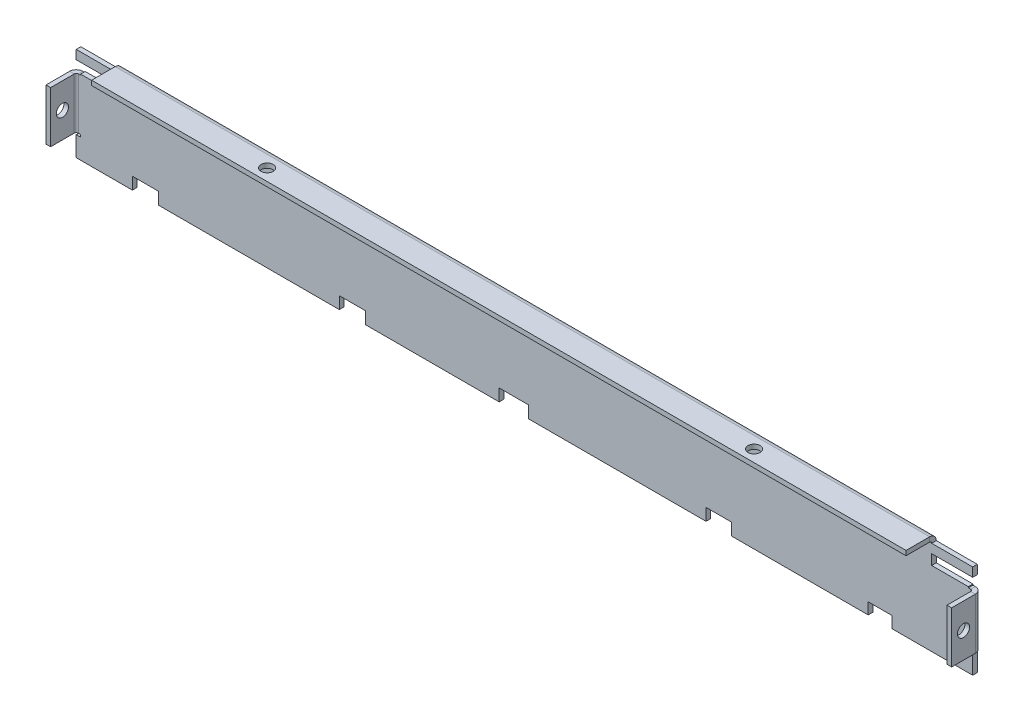
from build123d import *

# Parameters (mm, degrees)
SKETCH1_W                     = 444.26599996
SKETCH1_H                     = 47.498
BASE_FLANGE1_DEPTH            = 2.286
EDGE_FLANGE1_STRIP_W          = 11.144
EDGE_FLANGE1_STRIP_H          = 2.286
EDGE_FLANGE1_STRIP_CUT_DEPTH  = 25.4
EDGE_FLANGE1_RELIEF_W         = 12.287
EDGE_FLANGE1_RELIEF_H         = 1.143
EDGE_FLANGE1_RELIEF_CUT_DEPTH = 2.286
EDGE_FLANGE1_DEPTH            = 25.4
EDGE_FLANGE2_STRIP_W          = 11.144
EDGE_FLANGE2_STRIP_H          = 2.286
EDGE_FLANGE2_STRIP_CUT_DEPTH  = 25.4
EDGE_FLANGE2_RELIEF_W         = 12.287
EDGE_FLANGE2_RELIEF_H         = 1.143
EDGE_FLANGE2_RELIEF_CUT_DEPTH = 2.286
EDGE_FLANGE2_DEPTH            = 25.4
EDGE_FLANGE6_STRIP_W          = 11.144
EDGE_FLANGE6_STRIP_H          = 2.286
EDGE_FLANGE6_STRIP_CUT_DEPTH  = 444.26599996
EDGE_FLANGE6_DEPTH            = 444.26599996
SKETCH52_R                    = 3
CUT_EXTRUDE2_DEPTH            = 231.225159807
SKETCH53_R                    = 3
CUT_EXTRUDE3_DEPTH            = 450.771788169
SKETCH54_W                    = 20.32
SKETCH54_H                    = 3.286
CUT_EXTRUDE4_DEPTH            = 227.280796306
CUT_EXTRUDE6_DEPTH            = 227.280796306
CUT_EXTRUDE6_DEPTH_BACK       = 227.280796306
SKETCH57_W                    = 12.932384232
SKETCH57_H                    = 5.987852531
SKETCH57_W_2                  = 12.889095721
SKETCH57_H_2                  = 5.98785253
SKETCH57_W_3                  = 14.589217144
SKETCH57_H_3                  = 5.987852532
SKETCH57_W_4                  = 12.590694247
SKETCH57_H_4                  = 5.987852533
SKETCH57_W_5                  = 11.791285089
SKETCH57_H_5                  = 5.654723841


# Sheet-metal steps are written as plain solids
with BuildPart() as part:
    # Sketch1 → Base-Flange1 (new body)
    with BuildSketch(Plane.XY):
        Rectangle(SKETCH1_W, SKETCH1_H)
    extrude(amount=-BASE_FLANGE1_DEPTH)

    # Edge-Flange1 strip (across the edge) → Edge-Flange1 strip cut (cut)
    with BuildSketch(Plane(origin=(222.13299998, -12.7, 0), x_dir=(-1, 0, 0), z_dir=(0, 1, 0))):
        with Locations((-4.572, -1.143)):
            Rectangle(EDGE_FLANGE1_STRIP_W, EDGE_FLANGE1_STRIP_H)
    extrude(amount=EDGE_FLANGE1_STRIP_CUT_DEPTH, mode=Mode.SUBTRACT)

    # Edge-Flange1 relief (on the sheet) → Edge-Flange1 relief cut (cut)
    with BuildSketch(Plane(origin=(221.13299998, -12.7, 0), x_dir=(-1, 0, 0), z_dir=(0, 0, 1))):
        with Locations((-5.0005, 0.5715)):
            Rectangle(EDGE_FLANGE1_RELIEF_W, EDGE_FLANGE1_RELIEF_H)
        with Locations((-5.0005, -25.9715)):
            Rectangle(EDGE_FLANGE1_RELIEF_W, EDGE_FLANGE1_RELIEF_H)
    extrude(amount=-EDGE_FLANGE1_RELIEF_CUT_DEPTH, mode=Mode.SUBTRACT)

    # Edge-Flange1 section (across the edge) → Edge-Flange1 (add)
    with BuildSketch(Plane(origin=(222.13299998, -12.7, 0), x_dir=(-1, 0, 0), z_dir=(0, 1, 0))):
        with BuildLine():
            Line((-2.286, 1), (-2.286, 12.7))
            Line((-2.286, 12.7), (0, 12.7))
            Line((0, 12.7), (0, 1))
            ThreePointArc((0, 1), (0.292893219, 0.292893219), (1, 0))
            Line((1, 0), (1, -2.286))
            ThreePointArc((1, -2.286), (-1.323552883, -1.323552883), (-2.286, 1))
        make_face()
    extrude(amount=EDGE_FLANGE1_DEPTH)

    # Edge-Flange2 strip (across the edge) → Edge-Flange2 strip cut (cut)
    with BuildSketch(Plane(origin=(-222.13299998, 12.7, 0), x_dir=(1, 0, 0), z_dir=(0, -1, 0))):
        with Locations((-4.572, -1.143)):
            Rectangle(EDGE_FLANGE2_STRIP_W, EDGE_FLANGE2_STRIP_H)
    extrude(amount=EDGE_FLANGE2_STRIP_CUT_DEPTH, mode=Mode.SUBTRACT)

    # Edge-Flange2 relief (on the sheet) → Edge-Flange2 relief cut (cut)
    with BuildSketch(Plane(origin=(-221.13299998, 12.7, 0), x_dir=(1, 0, 0), z_dir=(0, 0, 1))):
        with Locations((-5.0005, 0.5715)):
            Rectangle(EDGE_FLANGE2_RELIEF_W, EDGE_FLANGE2_RELIEF_H)
        with Locations((-5.0005, -25.9715)):
            Rectangle(EDGE_FLANGE2_RELIEF_W, EDGE_FLANGE2_RELIEF_H)
    extrude(amount=-EDGE_FLANGE2_RELIEF_CUT_DEPTH, mode=Mode.SUBTRACT)

    # Edge-Flange2 section (across the edge) → Edge-Flange2 (add)
    with BuildSketch(Plane(origin=(-222.13299998, 12.7, 0), x_dir=(1, 0, 0), z_dir=(0, -1, 0))):
        with BuildLine():
            Line((-2.286, 1), (-2.286, 12.7))
            Line((-2.286, 12.7), (0, 12.7))
            Line((0, 12.7), (0, 1))
            ThreePointArc((0, 1), (0.292893219, 0.292893219), (1, 0))
            Line((1, 0), (1, -2.286))
            ThreePointArc((1, -2.286), (-1.323552883, -1.323552883), (-2.286, 1))
        make_face()
    extrude(amount=EDGE_FLANGE2_DEPTH)

    # Edge-Flange6 strip (across the edge) → Edge-Flange6 strip cut (cut)
    with BuildSketch(Plane(origin=(222.13299998, 23.749, 0), x_dir=(0, -1, 0), z_dir=(-1, 0, 0))):
        with Locations((-4.572, -1.143)):
            Rectangle(EDGE_FLANGE6_STRIP_W, EDGE_FLANGE6_STRIP_H)
    extrude(amount=EDGE_FLANGE6_STRIP_CUT_DEPTH, mode=Mode.SUBTRACT)

    # Edge-Flange6 section (across the edge) → Edge-Flange6 (add)
    with BuildSketch(Plane(origin=(222.13299998, 23.749, 0), x_dir=(0, -1, 0), z_dir=(-1, 0, 0))):
        with BuildLine():
            Line((-2.286, 1), (-2.286, 12.7))
            Line((-2.286, 12.7), (0, 12.7))
            Line((0, 12.7), (0, 1))
            ThreePointArc((0, 1), (0.292893219, 0.292893219), (1, 0))
            Line((1, 0), (1, -2.286))
            ThreePointArc((1, -2.286), (-1.323552883, -1.323552883), (-2.286, 1))
        make_face()
    extrude(amount=EDGE_FLANGE6_DEPTH)

    # Sketch52 → Cut-Extrude2 (cut, through all)
    with BuildSketch(Plane(origin=(0, 26.035, 0), x_dir=(1, 0, 0), z_dir=(0, 1, 0))):
        with Locations(Location((120.65, -6.85, 0), (0, 0, 270))):
            Circle(SKETCH52_R)
        with Locations(Location((-120.65, -6.85, 0), (0, 0, 270))):
            Circle(SKETCH52_R)
    extrude(amount=-CUT_EXTRUDE2_DEPTH, mode=Mode.SUBTRACT)

    # Sketch53 → Cut-Extrude3 (cut, through all)
    with BuildSketch(Plane(origin=(224.41899998, 0, 0), x_dir=(0, 0, -1), z_dir=(1, 0, 0))):
        with Locations((-6.85, 0)):
            Circle(SKETCH53_R)
    extrude(amount=-CUT_EXTRUDE3_DEPTH, mode=Mode.SUBTRACT)

    # Sketch54 → Cut-Extrude4 (cut, symmetric)
    with BuildSketch(Plane.XY):
        Polygon((222.13299998, 13.843), (222.13299998, 18.296), (201.81299998, 18.296), (201.81299998, 13.216), (219.98999998, 13.216), (219.98999998, 13.843), align=None)
        with Locations((211.97299998, 24.392)):
            Rectangle(SKETCH54_W, SKETCH54_H)
    cut_extrude4 = extrude(amount=CUT_EXTRUDE4_DEPTH, both=True, mode=Mode.SUBTRACT)

    # Mirror1: Cut-Extrude4 across plane
    add(cut_extrude4.mirror(Plane(origin=(0, 0, 0), x_dir=(0, 0, 1), z_dir=(1, 0, 0))), mode=Mode.SUBTRACT)

    # Sketch57 → Cut-Extrude6 (cut, two sides: drawn at the far end of the back side and taken through both)
    with BuildSketch(Plane.XY.offset(-CUT_EXTRUDE6_DEPTH_BACK)):
        with Locations((-85.29165905, -20.755073735)):
            Rectangle(SKETCH57_W, SKETCH57_H)
        with Locations((-187.864563379, -20.755073735)):
            Rectangle(SKETCH57_W_2, SKETCH57_H_2)
        with Locations((-5.245477464, -20.755073734)):
            Rectangle(SKETCH57_W_3, SKETCH57_H_3)
        with Locations((96.279485673, -20.755073734)):
            Rectangle(SKETCH57_W_4, SKETCH57_H_4)
        with Locations((176.220401529, -20.921638079)):
            Rectangle(SKETCH57_W_5, SKETCH57_H_5)
    extrude(amount=CUT_EXTRUDE6_DEPTH + CUT_EXTRUDE6_DEPTH_BACK, mode=Mode.SUBTRACT)


solid = part.part
